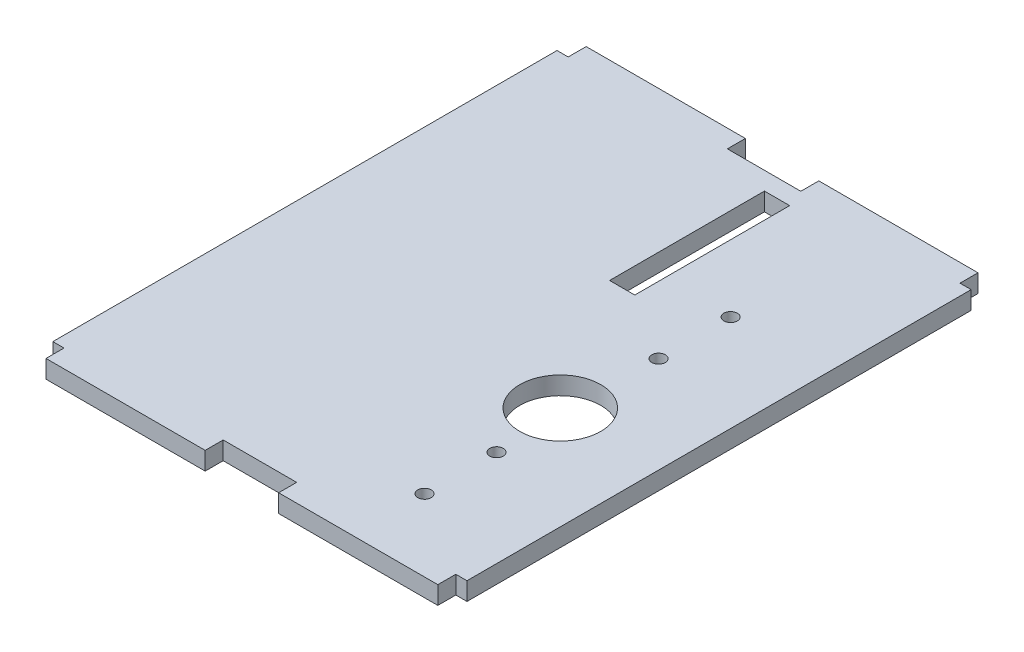
from build123d import *

# Parameters (mm, degrees)
SKETCH1_W           = 292.1
SKETCH1_H           = 355.6
SKETCH1_RX          = 28.575
SKETCH1_RY          = 28.573991153
BOSS_EXTRUDE1_DEPTH = 12.7
SKETCH2_R           = 4.7625
CUT_EXTRUDE1_DEPTH  = 12.7
SKETCH3_W           = 112.268
SKETCH3_H           = 12.7
BOSS_EXTRUDE2_DEPTH = 12.7
SKETCH5_W           = 17.78
SKETCH5_H           = 109.22
CUT_EXTRUDE2_DEPTH  = 471.243117972


with BuildPart() as part:
    # Sketch1 → Boss-Extrude1 (new body)
    with BuildSketch(Plane(origin=(0, 0, 0), x_dir=(1, 0, 0), z_dir=(0, 1, 0))):
        with Locations((146.05, 177.8)):
            Rectangle(SKETCH1_W, SKETCH1_H)
        with Locations(Location((219.512197498, 138.386094447), (0, 0, 0))):
            Ellipse(SKETCH1_RX, SKETCH1_RY, mode=Mode.SUBTRACT)
    extrude(amount=BOSS_EXTRUDE1_DEPTH)

    # Sketch2 → Cut-Extrude1 (cut)
    with BuildSketch(Plane.XZ):
        with Locations((224.028, -38.1)):
            Circle(SKETCH2_R)
        with Locations((224.028, -88.9)):
            Circle(SKETCH2_R)
        with Locations((224.028, -203.2)):
            Circle(SKETCH2_R)
        with Locations((224.028, -254)):
            Circle(SKETCH2_R)
    extrude(amount=-CUT_EXTRUDE1_DEPTH, mode=Mode.SUBTRACT)

    # Sketch3 → Boss-Extrude2 (add)
    with BuildSketch(Plane(origin=(0, 12.7, 0), x_dir=(1, 0, 0), z_dir=(0, 1, 0))):
        with Locations((64.008, 361.95)):
            Rectangle(SKETCH3_W, SKETCH3_H)
        with Locations((228.092, 361.95)):
            Rectangle(SKETCH3_W, SKETCH3_H)
        with Locations((228.092, -6.35)):
            Rectangle(SKETCH3_W, SKETCH3_H)
        with Locations((64.008, -6.35)):
            Rectangle(SKETCH3_W, SKETCH3_H)
    extrude(amount=-BOSS_EXTRUDE2_DEPTH)

    # Sketch5 → Cut-Extrude2 (cut, through all)
    with BuildSketch(Plane(origin=(0, 12.7, 0), x_dir=(1, 0, 0), z_dir=(0, 1, 0))):
        with Locations((167.894, 288.29)):
            Rectangle(SKETCH5_W, SKETCH5_H)
    extrude(amount=-CUT_EXTRUDE2_DEPTH, mode=Mode.SUBTRACT)


solid = part.part
